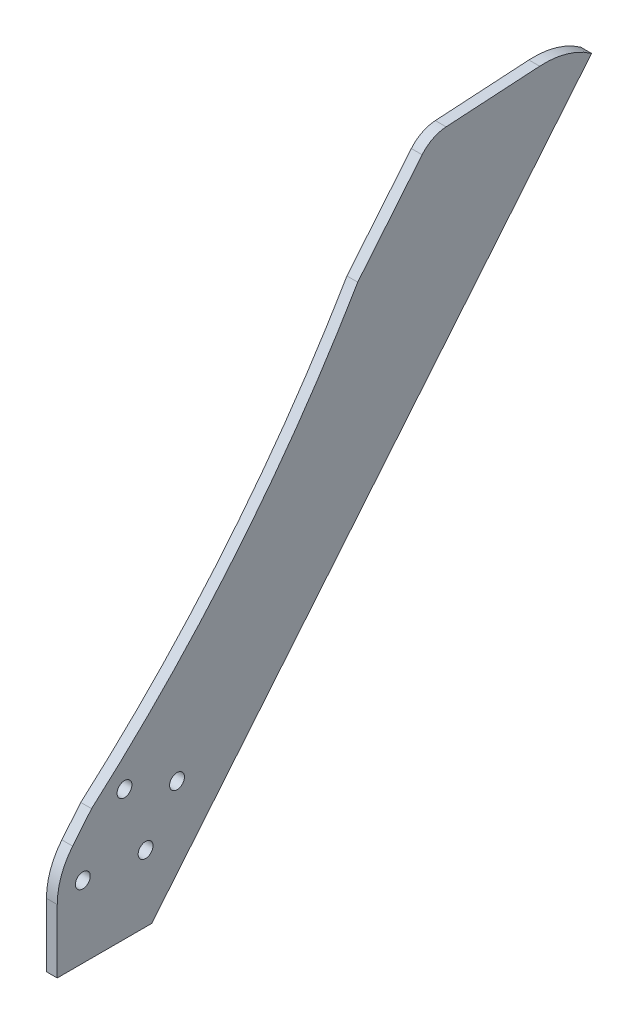
from build123d import *

# Parameters (mm, degrees)
BASE_FLANGE1_DEPTH = 16
SKETCH3_R          = 11
CUT_HOLES_DEPTH    = 1042.876868884


# Sheet-metal steps are written as plain solids
with BuildPart() as part:
    # Sketch1 → Base-Flange1 (new body)
    with BuildSketch(Plane(origin=(0, 0, 0), x_dir=(0, 0, -1), z_dir=(1, 0, 0))):
        with BuildLine():
            Line((305.218612063, 670.218640107), (400.630345104, 785.962327615))
            ThreePointArc((400.630345104, 785.962327615), (416.512049286, 798.70874281), (436.159147295, 804.065156521))
            Line((436.159147295, 804.065156521), (574.750134607, 812.541744435))
            ThreePointArc((574.750134607, 812.541744435), (615.094497482, 808.133571726), (651.662136675, 790.529385681))
            Line((651.662136675, 790.529385681), (0, 0))
            Line((0, 0), (-140, 0))
            Line((-140, 0), (-140, 94.22160699))
            ThreePointArc((-140, 94.22160699), (-134.117601526, 128.01327879), (-117.162458339, 157.829429018))
            Line((-117.162458339, 157.829429018), (-89.113742378, 191.855242319))
            ThreePointArc((-89.113742378, 191.855242319), (127.343049427, 415.134985706), (305.218612063, 670.218640107))
        make_face()
    extrude(amount=-BASE_FLANGE1_DEPTH)

    # Sketch3 → Cut-Holes (cut, through all)
    with BuildSketch(Plane(origin=(0, 0, 0), x_dir=(0, 0, -1), z_dir=(1, 0, 0))):
        with Locations((-40.344519187, 192.562071849)):
            Circle(SKETCH3_R)
        with Locations((-102.086703913, 106.4)):
            Circle(SKETCH3_R)
        with Locations((-9.1, 98.818911988)):
            Circle(SKETCH3_R)
        with Locations((37.497875264, 163.846890742)):
            Circle(SKETCH3_R)
    extrude(amount=-CUT_HOLES_DEPTH, mode=Mode.SUBTRACT)


solid = part.part
